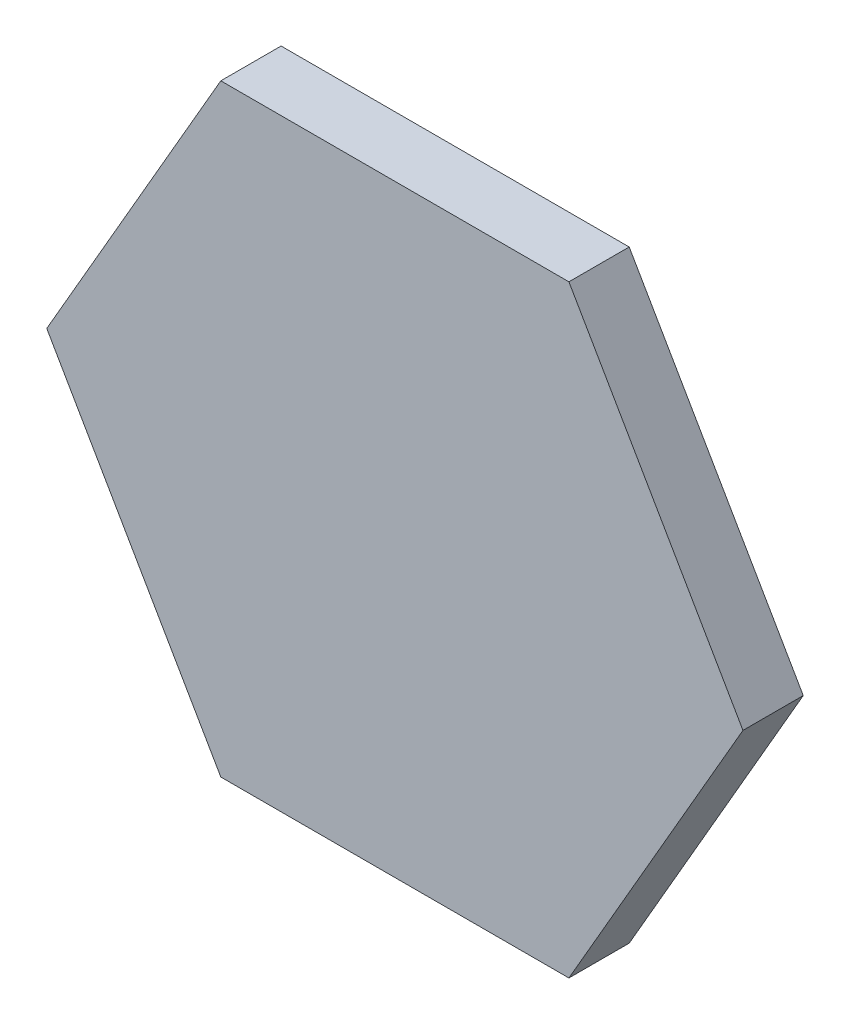
from build123d import *

# Parameters (mm, degrees)
BOSS_EXTRUDE1_DEPTH = 5
SKETCH2_R           = 9
CUT_EXTRUDE1_DEPTH  = 5


with BuildPart() as part:
    # Sketch1 → Boss-Extrude1 (new, symmetric)
    with BuildSketch(Plane.XY):
        Polygon((57.735026919, 0), (28.867513459, 50), (-28.867513459, 50), (-57.735026919, 0), (-28.867513459, -50), (28.867513459, -50), align=None)
    extrude(amount=BOSS_EXTRUDE1_DEPTH, both=True)

    # Sketch2 → Cut-Extrude1 (cut)
    with BuildSketch(Plane(origin=(0, 0, -5), x_dir=(-1, 0, 0), z_dir=(0, 0, -1))):
        with Locations((-20.207259422, -35)):
            Circle(SKETCH2_R)
        with Locations((-40.414518843, 0)):
            Circle(SKETCH2_R)
        with Locations((-20.207259422, 35)):
            Circle(SKETCH2_R)
        with Locations((20.207259422, 35)):
            Circle(SKETCH2_R)
        with Locations((40.414518843, 0)):
            Circle(SKETCH2_R)
        with Locations((20.207259422, -35)):
            Circle(SKETCH2_R)
    extrude(amount=-CUT_EXTRUDE1_DEPTH, mode=Mode.SUBTRACT)


solid = part.part
